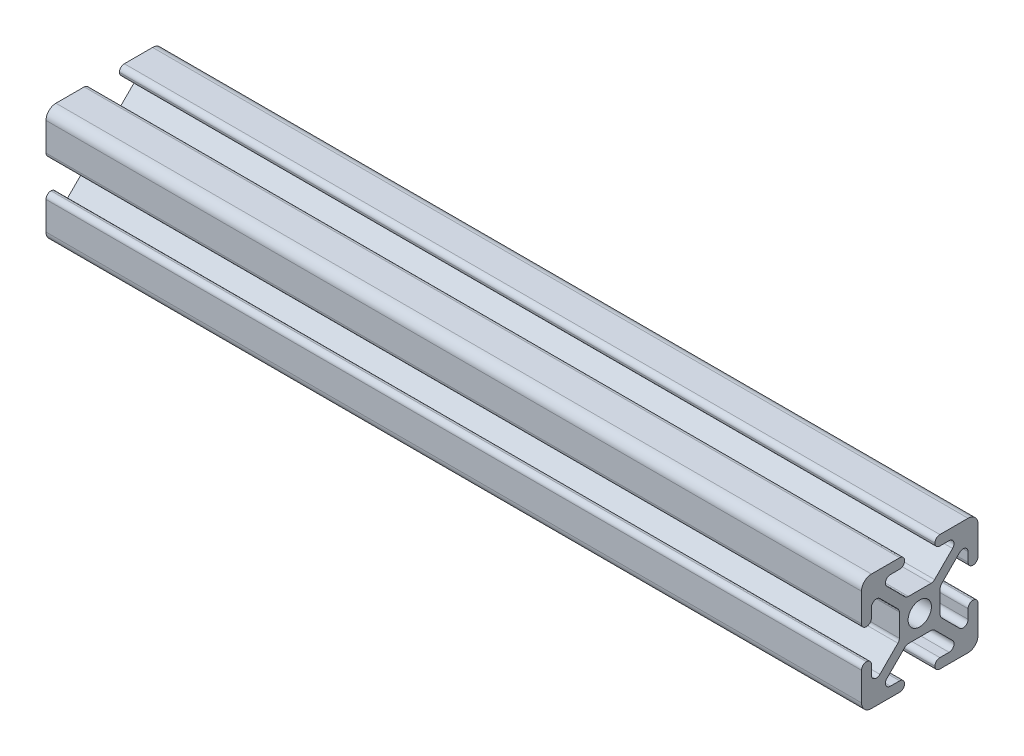
from build123d import *

# Parameters (mm, degrees)
SKETCH1_R           = 2.5
BOSS_EXTRUDE1_DEPTH = 175
FILLET1_R           = 1.065
FILLET2_R           = 2.13


with BuildPart() as part:
    # Sketch1 → Boss-Extrude1 (new body)
    with BuildSketch(Plane.YZ):
        Polygon((-12.5, -3.25), (-12.5, -12.5), (-3.25, -12.5), (-3.25, -10.37), (-8.863862556, -10.37), (-2.873862556, -4.38), (2.873862556, -4.38), (8.863862556, -10.37), (3.25, -10.37), (3.25, -12.5), (12.5, -12.5), (12.5, -3.25), (10.37, -3.25), (10.37, -8.863862556), (4.38, -2.873862556), (4.38, 2.873862556), (10.37, 8.863862556), (10.37, 3.25), (12.5, 3.25), (12.5, 12.5), (3.25, 12.5), (3.25, 10.37), (8.863862556, 10.37), (2.873862556, 4.38), (-2.873862556, 4.38), (-8.863862556, 10.37), (-3.25, 10.37), (-3.25, 12.5), (-12.5, 12.5), (-12.5, 3.25), (-10.37, 3.25), (-10.37, 8.863862556), (-4.38, 2.873862556), (-4.38, -2.873862556), (-10.37, -8.863862556), (-10.37, -3.25), align=None)
        with Locations(Location((0, 0, 0), (0, 0, 270))):
            Circle(SKETCH1_R, mode=Mode.SUBTRACT)
    extrude(amount=BOSS_EXTRUDE1_DEPTH)

    # Fillet1
    fillet1_edges = [part.edges().sort_by_distance(p)[0] for p in [
        (87.5, -10.37, -8.863862556),
        (87.5, 2.873862556, -4.38),
        (87.5, -2.873862556, -4.38),
        (87.5, -4.38, 2.873862556),
        (87.5, -4.38, -2.873862556),
        (87.5, -2.873862556, 4.38),
        (87.5, 2.873862556, 4.38),
        (87.5, 4.38, 2.873862556),
        (87.5, 4.38, -2.873862556),
        (87.5, -8.863862556, -10.37),
        (87.5, 8.863862556, -10.37),
        (87.5, 10.37, -8.863862556),
        (87.5, -10.37, 8.863862556),
        (87.5, -8.863862556, 10.37),
        (87.5, 10.37, 8.863862556),
        (87.5, 8.863862556, 10.37),
        (87.5, 12.5, 3.25),
        (87.5, -3.25, -12.5),
        (87.5, -10.37, 3.25),
        (87.5, 10.37, 3.25),
        (87.5, -10.37, -3.25),
        (87.5, -12.5, -3.25),
        (87.5, -12.5, 3.25),
        (87.5, 3.25, -10.37),
        (87.5, -3.25, -10.37),
        (87.5, 3.25, -12.5),
        (87.5, 10.37, -3.25),
        (87.5, 12.5, -3.25),
        (87.5, 3.25, 12.5),
        (87.5, 3.25, 10.37),
        (87.5, -3.25, 10.37),
        (87.5, -3.25, 12.5),
    ]]
    fillet(fillet1_edges, radius=FILLET1_R - 0.0001)  # a hair under: the kernel refuses the full size

    # Fillet2
    fillet2_edges = [part.edges().sort_by_distance(p)[0] for p in [
        (87.5, -12.5, 12.5),
        (87.5, 12.5, 12.5),
        (87.5, 12.5, -12.5),
        (87.5, -12.5, -12.5),
    ]]
    fillet(fillet2_edges, radius=FILLET2_R)


solid = part.part
